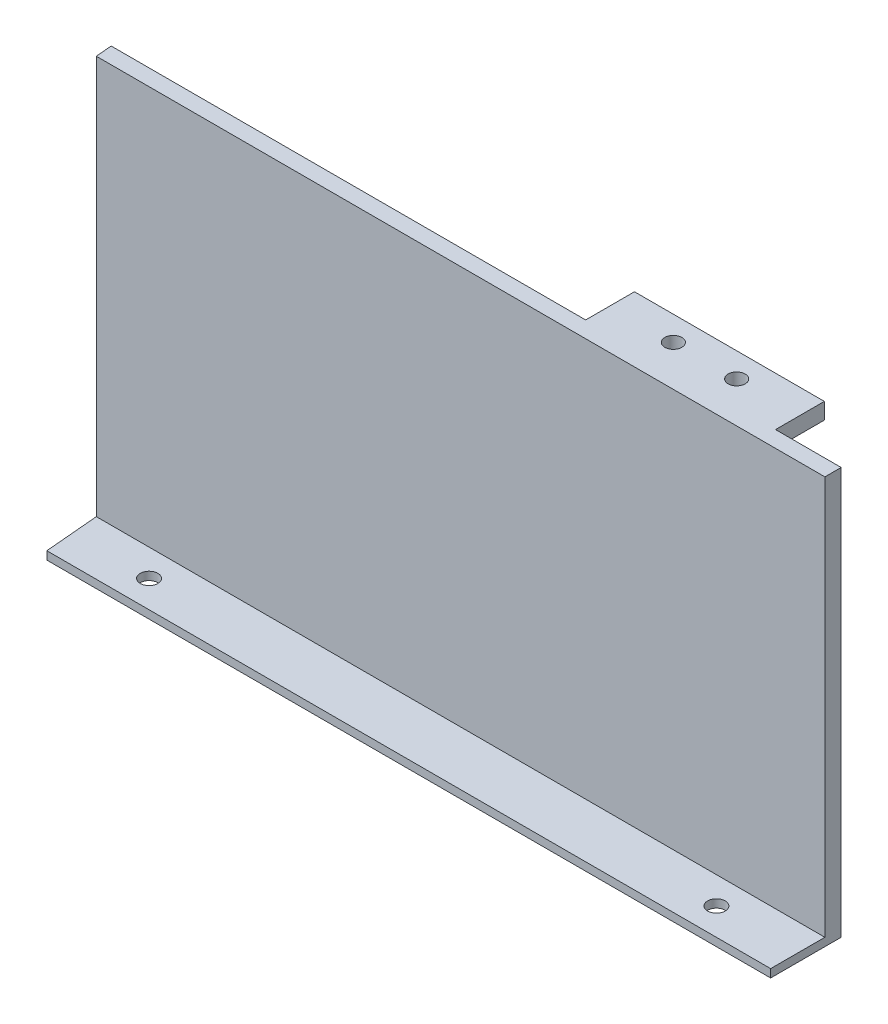
from build123d import *

# Parameters (mm, degrees)
SKETCH1_W           = 134.58
SKETCH1_H           = 3
BOSS_EXTRUDE1_DEPTH = 75
SKETCH2_W           = 35
SKETCH2_H           = 3
BOSS_EXTRUDE2_DEPTH = 9
SKETCH3_R           = 1.575
CUT_EXTRUDE1_DEPTH  = 155.534062265
SKETCH4_W           = 134.58
SKETCH4_H           = 1.5
BOSS_EXTRUDE3_DEPTH = 10
SKETCH5_R           = 1.625
CUT_EXTRUDE2_DEPTH  = 155.534062265


with BuildPart() as part:
    # Sketch1 → Boss-Extrude1 (new body)
    with BuildSketch(Plane(origin=(0, 0, 0), x_dir=(1, 0, 0), z_dir=(0, 1, 0))):
        with Locations((67.29, 1.5)):
            Rectangle(SKETCH1_W, SKETCH1_H)
    extrude(amount=BOSS_EXTRUDE1_DEPTH)

    # Sketch2 → Boss-Extrude2 (add)
    with BuildSketch(Plane(origin=(0, 0, -3), x_dir=(-1, 0, 0), z_dir=(0, 0, -1))):
        with Locations((-104.98, 73.5)):
            Rectangle(SKETCH2_W, SKETCH2_H)
    extrude(amount=BOSS_EXTRUDE2_DEPTH)

    # Sketch3 → Cut-Extrude1 (cut, through all)
    with BuildSketch(Plane(origin=(0, 75, 0), x_dir=(1, 0, 0), z_dir=(0, 1, 0))):
        with Locations((110.813333333, 7.5)):
            Circle(SKETCH3_R)
        with Locations((99.146666667, 7.5)):
            Circle(SKETCH3_R)
    extrude(amount=-CUT_EXTRUDE1_DEPTH, mode=Mode.SUBTRACT)

    # Sketch4 → Boss-Extrude3 (add)
    with BuildSketch(Plane.XY):
        with Locations((67.29, 0.75)):
            Rectangle(SKETCH4_W, SKETCH4_H)
    extrude(amount=BOSS_EXTRUDE3_DEPTH)

    # Sketch5 → Cut-Extrude2 (cut, through all)
    with BuildSketch(Plane.XZ):
        with Locations((15, 5)):
            Circle(SKETCH5_R)
        with Locations((119.58, 5)):
            Circle(SKETCH5_R)
        Polygon((0, 10), (1.16, 10), (0.02, -3), (0, -3), align=None)
    extrude(amount=-CUT_EXTRUDE2_DEPTH, mode=Mode.SUBTRACT)


solid = part.part
